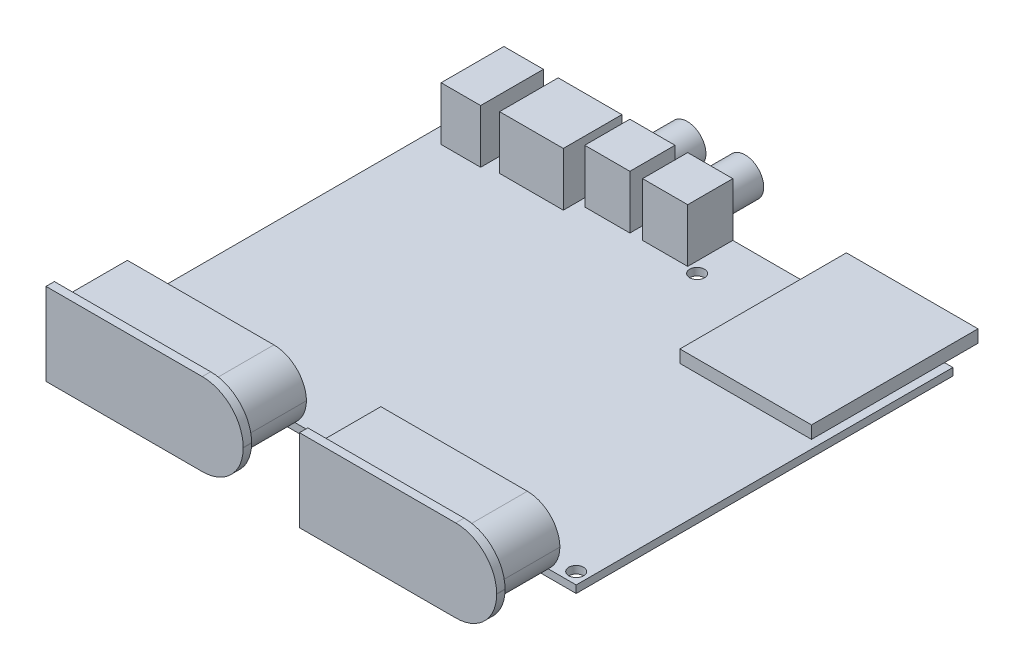
from build123d import *

# Parameters (mm, degrees)
SKETCH1_W            = 100
SKETCH1_H            = 81
BOSS_EXTRUDE1_DEPTH  = 1.6
SKETCH2_W            = 38.5
SKETCH2_H            = 13.8
BOSS_EXTRUDE2_DEPTH  = 14
SKETCH3_W            = 42.4
SKETCH3_H            = 17.7
BOSS_EXTRUDE3_DEPTH  = 1.8
SKETCH4_W            = 8.5
SKETCH4_H            = 13.5
SKETCH4_W_2          = 13.7
SKETCH4_H_2          = 12.6
SKETCH4_W_3          = 9.7
SKETCH4_H_3          = 9.7
BOSS_EXTRUDE4_DEPTH  = 11.5
SKETCH5_W            = 28.3
SKETCH5_H            = 35.8
BOSS_EXTRUDE5_DEPTH  = 2.7
SKETCH6_R            = 4
BOSS_EXTRUDE6_DEPTH  = 7.5
M3_CLEARANCE_SLOT1_D = 3.2
FILLET1_R            = 7
FILLET2_R            = 8.8


with BuildPart() as part:
    # Sketch1 → Boss-Extrude1 (new body)
    with BuildSketch(Plane(origin=(0, 0, 0), x_dir=(1, 0, 0), z_dir=(0, 1, 0))):
        with Locations((50, 40.5)):
            Rectangle(SKETCH1_W, SKETCH1_H)
    extrude(amount=BOSS_EXTRUDE1_DEPTH)

    # Sketch2 → Boss-Extrude2 (add)
    with BuildSketch(Plane.XY):
        with Locations((77.25, 6.9)):
            Rectangle(SKETCH2_W, SKETCH2_H)
        with Locations((22.75, 6.9)):
            Rectangle(SKETCH2_W, SKETCH2_H)
    extrude(amount=BOSS_EXTRUDE2_DEPTH)

    # Sketch3 → Boss-Extrude3 (add)
    with BuildSketch(Plane.XY.offset(14)):
        with Locations((23, 7.15)):
            Rectangle(SKETCH3_W, SKETCH3_H)
        with Locations((77.5, 7.15)):
            Rectangle(SKETCH3_W, SKETCH3_H)
    extrude(amount=BOSS_EXTRUDE3_DEPTH)

    # Sketch4 → Boss-Extrude4 (add)
    with BuildSketch(Plane(origin=(0, 1.6, 0), x_dir=(1, 0, 0), z_dir=(0, 1, 0))):
        with Locations((7.706498822, 74.25)):
            Rectangle(SKETCH4_W, SKETCH4_H)
        with Locations((21.980965093, 74.7)):
            Rectangle(SKETCH4_W_2, SKETCH4_H_2)
        with Locations((35.395626501, 76.15)):
            Rectangle(SKETCH4_W_3, SKETCH4_H_3)
        with Locations((47.82718522, 76.15)):
            Rectangle(SKETCH4_W_3, SKETCH4_H_3)
    extrude(amount=BOSS_EXTRUDE4_DEPTH)

    # Sketch5 → Boss-Extrude5 (add)
    with BuildSketch(Plane(origin=(0, 1.6, 0), x_dir=(1, 0, 0), z_dir=(0, 1, 0))):
        with Locations((84.05, 70.3)):
            Rectangle(SKETCH5_W, SKETCH5_H)
    extrude(amount=BOSS_EXTRUDE5_DEPTH)

    # Sketch6 → Boss-Extrude6 (add)
    with BuildSketch(Plane(origin=(0, 0, -81), x_dir=(-1, 0, 0), z_dir=(0, 0, -1))):
        with Locations(Location((-47.82718522, 7.35, 0), (0, 0, 180))):
            Circle(SKETCH6_R)
        with Locations(Location((-35.395626501, 7.35, 0), (0, 0, 180))):
            Circle(SKETCH6_R)
    extrude(amount=BOSS_EXTRUDE6_DEPTH)

    # M3 Clearance Slot1 (through all)
    with Locations(Plane(origin=(0, 1.6, 0), x_dir=(1, 0, 0), z_dir=(0, 1, 0))):
        with Locations((55, 71), (97.5, 2.5), (2.5, 2.5)):
            Hole(M3_CLEARANCE_SLOT1_D / 2)

    # Fillet1
    # the kernel refuses this fillet: 7 mm, written as the material it takes off along each edge
    with BuildSketch(Plane(origin=(42, 0, 0), x_dir=(-1, 0, 0), z_dir=(0, 0, 1)), Plane(origin=(96.5, 0, 0), x_dir=(-1, 0, 0), z_dir=(0, 0, 1))) as fillet1_piece_1:
        with BuildLine():
            CenterArc((FILLET1_R, -FILLET1_R), FILLET1_R, 90, 90)
            Line((0, -FILLET1_R), (0, 0))
            Line((0, 0), (FILLET1_R, 0))
        make_face()
    extrude(amount=14, mode=Mode.SUBTRACT)
    with BuildSketch(Plane(origin=(42, 13.8, -17.5), x_dir=(0, -1, 0), z_dir=(0, 0, 1)), Plane(origin=(96.5, 13.8, -17.5), x_dir=(0, -1, 0), z_dir=(0, 0, 1))) as fillet1_piece_2:
        with BuildLine():
            CenterArc((FILLET1_R, -FILLET1_R), FILLET1_R, 90, 90)
            Line((0, -FILLET1_R), (0, 0))
            Line((0, 0), (FILLET1_R, 0))
        make_face()
    extrude(amount=31.5, mode=Mode.SUBTRACT)

    # Fillet2
    fillet2_edges = [part.edges().sort_by_distance(p)[0] for p in [
        (44.2, -1.7, 14.9),
        (44.2, 16, 14.9),
        (98.7, -1.7, 14.9),
        (98.7, 16, 14.9),
    ]]
    fillet(fillet2_edges, radius=FILLET2_R)


solid = part.part
